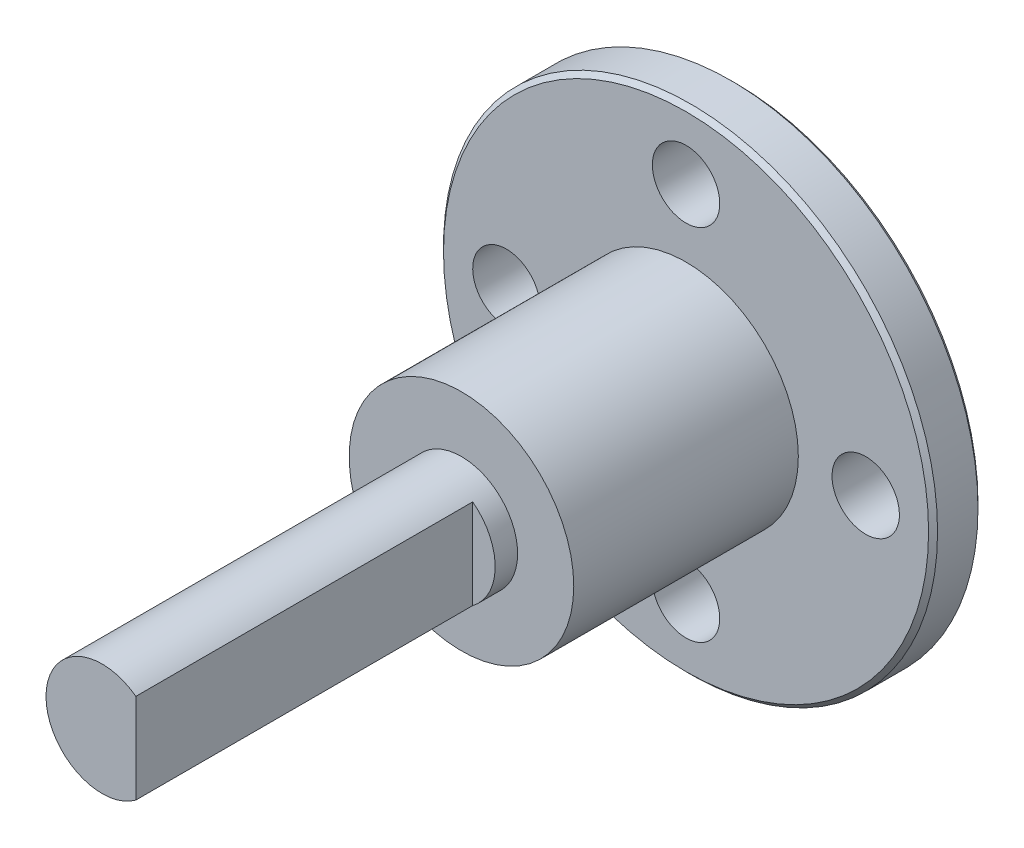
from build123d import *

# Parameters (mm, degrees)
SKETCH_1_R               = 11
EXTRUDE_1_DEPTH          = 2.2
SKETCH_2_R               = 5
EXTRUDE_2_DEPTH          = 10
F_3_0MM_1_D              = 3
PATTERN_CIRCULAR_1_COUNT = 4
CHAMFER_3_SIZE           = 0.2
SKETCH_12_R              = 2.5
EXTRUDE_1789_DEPTH       = 26
CUT_EXTRUDE_START        = -15
CUT_EXTRUDE_1_DEPTH      = 15


with BuildPart() as part:
    # 草图1 → 凸台-拉伸1 (new body)
    with BuildSketch(Plane.XY):
        Circle(SKETCH_1_R)
    extrude(amount=EXTRUDE_1_DEPTH)

    # 草图2 → 凸台-拉伸2 (add)
    with BuildSketch(Plane.XY.offset(2.2)):
        Circle(SKETCH_2_R)
    extrude(amount=EXTRUDE_2_DEPTH)

    # Ø3.0mm 暗销孔1 (through all)
    with Locations(Plane.XY.offset(2.2)):
        with Locations((0, 8)):
            f_3_0mm_1 = Hole(F_3_0MM_1_D / 2)

    # 阵列(圆周)1: Ø3.0mm 暗销孔1 ×4 about axis
    pattern_circular_1_axis = Axis((0, 0, 2.2), (0, 0, -1))
    for i in range(1, PATTERN_CIRCULAR_1_COUNT):
        add(f_3_0mm_1.rotate(pattern_circular_1_axis, i * 360 / PATTERN_CIRCULAR_1_COUNT), mode=Mode.SUBTRACT)

    # 倒角3
    chamfer_3_edges = [part.edges().sort_by_distance(p)[0] for p in [
        (-11, 0, 0),
        (-11, 0, 2.2),
    ]]
    chamfer(chamfer_3_edges, length=CHAMFER_3_SIZE)

    # 草图12 → Extrude 1789 (add)
    with BuildSketch(Plane.XY.offset(2.2)):
        Circle(SKETCH_12_R)
    extrude(amount=EXTRUDE_1789_DEPTH)

    # 草图13 → 切除-拉伸1 (cut)
    with BuildSketch(Plane.XY.offset(28.2).offset(CUT_EXTRUDE_START)):
        with BuildLine():
            Line((1.5, 2), (1.5, -2))
            ThreePointArc((1.5, -2), (2.5, 0), (1.5, 2))
        make_face()
    extrude(amount=CUT_EXTRUDE_1_DEPTH, mode=Mode.SUBTRACT)


solid = part.part
